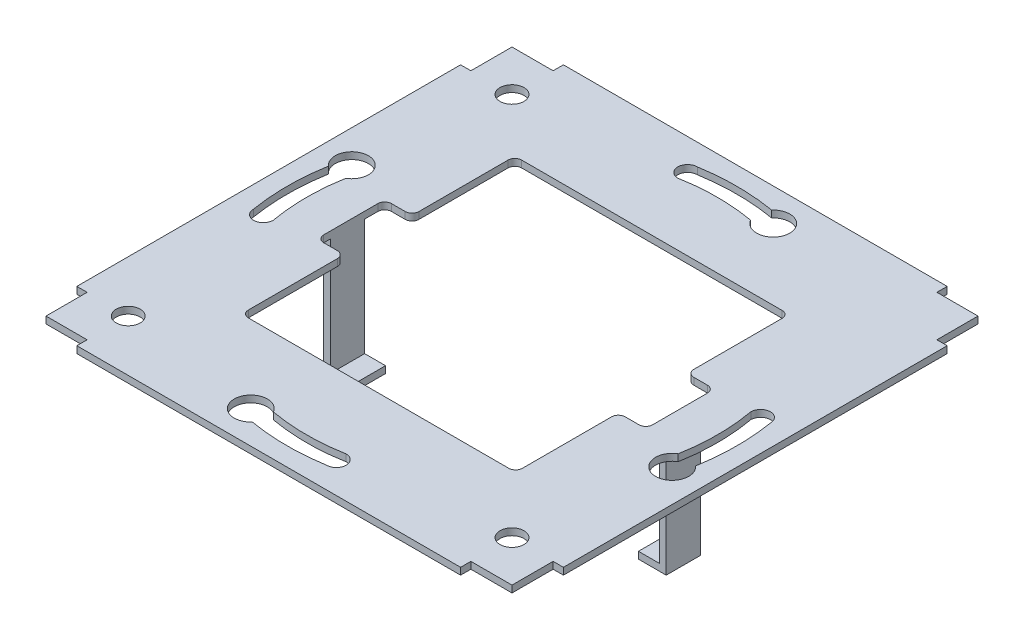
from build123d import *

# Parameters (mm, degrees)
SKETCH_2_R      = 1.75
EXTRUDE_1_DEPTH = 1
EXTRUDE_2_DEPTH = 2.5


with BuildPart() as part:
    # Эскиз2 → Бобышка-Вытянуть1 (new body)
    with BuildSketch(Plane(origin=(0, 0, 0), x_dir=(1, 0, 0), z_dir=(0, 1, 0))):
        Polygon((-35.5, 28), (-35.5, -28), (-34, -28), (-34, -34), (-28, -34), (-28, -35.5), (28, -35.5), (28, -34), (34, -34), (34, -28), (35.5, -28), (35.5, 28), (34, 28), (34, 34), (28, 34), (28, 35.5), (-28, 35.5), (-28, 34), (-34, 34), (-34, 28), align=None)
        with Locations((28, -28)):
            Circle(SKETCH_2_R, mode=Mode.SUBTRACT)
        with Locations((-28, -28)):
            Circle(SKETCH_2_R, mode=Mode.SUBTRACT)
        with Locations((-28, 28)):
            Circle(SKETCH_2_R, mode=Mode.SUBTRACT)
        with BuildLine():
            Line((20, 19.418145483), (20, 6.525504327))
            ThreePointArc((20, 6.525504327), (20.292893219, 5.818397545), (21, 5.525504327))
            Line((21, 5.525504327), (23, 5.525504327))
            ThreePointArc((23, 5.525504327), (23.707106781, 5.232611108), (24, 4.525504327))
            Line((24, 4.525504327), (24, -3.474495673))
            ThreePointArc((24, -3.474495673), (23.707106781, -4.181602455), (23, -4.474495673))
            Line((23, -4.474495673), (21, -4.474495673))
            ThreePointArc((21, -4.474495673), (20.292893219, -4.767388892), (20, -5.474495673))
            Line((20, -5.474495673), (20, -18.474495673))
            ThreePointArc((20, -18.474495673), (19.707106781, -19.181602455), (19, -19.474495673))
            Line((19, -19.474495673), (-19, -19.474495673))
            ThreePointArc((-19, -19.474495673), (-19.707106781, -19.181602455), (-20, -18.474495673))
            Line((-20, -18.474495673), (-20, -5.474495673))
            ThreePointArc((-20, -5.474495673), (-20.292893219, -4.767388892), (-21, -4.474495673))
            Line((-21, -4.474495673), (-23, -4.474495673))
            ThreePointArc((-23, -4.474495673), (-23.707106781, -4.181602455), (-24, -3.474495673))
            Line((-24, -3.474495673), (-24, 4.418145483))
            ThreePointArc((-24, 4.418145483), (-23.707106781, 5.125252264), (-23, 5.418145483))
            Line((-23, 5.418145483), (-21, 5.418145483))
            ThreePointArc((-21, 5.418145483), (-20.292893219, 5.711038701), (-20, 6.418145483))
            Line((-20, 6.418145483), (-20, 19.418145483))
            ThreePointArc((-20, 19.418145483), (-19.707106781, 20.125252264), (-19, 20.418145483))
            Line((-19, 20.418145483), (19, 20.418145483))
            ThreePointArc((19, 20.418145483), (19.707106781, 20.125252264), (20, 19.418145483))
        make_face(mode=Mode.SUBTRACT)
        with BuildLine():
            ThreePointArc((-32.375246916, -5.328874762), (-32.81067753, 0.113838264), (-32.337490331, 5.553398796))
            ThreePointArc((-32.337490331, 5.553398796), (-30.509920838, 9.7779661), (-29.531671369, 5.280188077))
            ThreePointArc((-29.531671369, 5.280188077), (-29.999989805, -0.024733046), (-29.522924885, -5.328874762))
            ThreePointArc((-29.522924885, -5.328874762), (-30.949085901, -6.755035778), (-32.375246916, -5.328874762))
        make_face(mode=Mode.SUBTRACT)
        with BuildLine():
            ThreePointArc((5.553398796, 32.337490331), (9.7779661, 30.509920838), (5.280188077, 29.531671369))
            ThreePointArc((5.280188077, 29.531671369), (-0.024733046, 29.999989805), (-5.328874762, 29.522924885))
            ThreePointArc((-5.328874762, 29.522924885), (-6.755035778, 30.949085901), (-5.328874762, 32.375246916))
            ThreePointArc((-5.328874762, 32.375246916), (0.113838264, 32.81067753), (5.553398796, 32.337490331))
        make_face(mode=Mode.SUBTRACT)
        with BuildLine():
            ThreePointArc((32.337490331, -5.553398796), (30.509920838, -9.7779661), (29.531671369, -5.280188077))
            ThreePointArc((29.531671369, -5.280188077), (29.999989805, 0.024733046), (29.522924885, 5.328874762))
            ThreePointArc((29.522924885, 5.328874762), (30.949085901, 6.755035778), (32.375246916, 5.328874762))
            ThreePointArc((32.375246916, 5.328874762), (32.81067753, -0.113838264), (32.337490331, -5.553398796))
        make_face(mode=Mode.SUBTRACT)
        with BuildLine():
            ThreePointArc((-5.553398796, -32.337490331), (-9.7779661, -30.509920838), (-5.280188077, -29.531671369))
            ThreePointArc((-5.280188077, -29.531671369), (0.024733046, -29.999989805), (5.328874762, -29.522924885))
            ThreePointArc((5.328874762, -29.522924885), (6.755035778, -30.949085901), (5.328874762, -32.375246916))
            ThreePointArc((5.328874762, -32.375246916), (-0.113838264, -32.81067753), (-5.553398796, -32.337490331))
        make_face(mode=Mode.SUBTRACT)
    extrude(amount=EXTRUDE_1_DEPTH)

    # Эскиз3 → Бобышка-Вытянуть2 (add, symmetric)
    with BuildSketch(Plane.XY):
        Polygon((-25, 0), (-24, 0), (-24, -17), (-20.953427174, -17), (-20.953427174, -18), (-25, -18), align=None)
        Polygon((25, 0), (25, -18), (20.953427174, -18), (20.953427174, -17), (24, -17), (24, 0), align=None)
    extrude(amount=EXTRUDE_2_DEPTH, both=True)


solid = part.part
